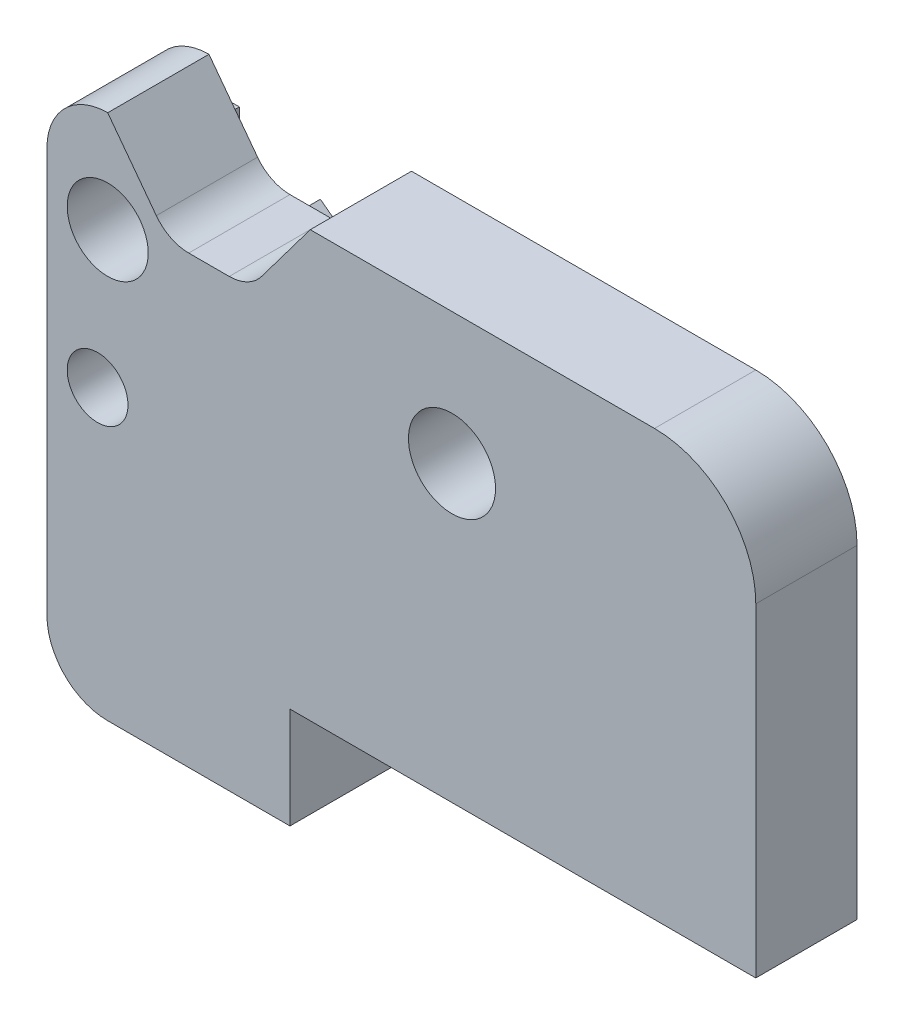
from build123d import *

# Parameters (mm, degrees)
SKETCH1_W             = 23
SKETCH1_H             = 21
EXTRUDE1_DEPTH        = 5
SKETCH2_R             = 2.15
EXTRUDE2_DEPTH        = 4.5
SKETCH4_R             = 1.25
EXTRUDE4_DEPTH        = 8
FILLET1_R             = 5
SKETCH6_R             = 4.5
EXTRUDE6_DEPTH        = 4.5
SKETCH9_W             = 12
SKETCH9_H             = 26
EXTRUDE9_DEPTH        = 5
SKETCH10_R            = 2
EXTRUDE10_DEPTH       = 4
SKETCH11_R            = 1.5
EXTRUDE11_DEPTH       = 5
M3_TAPPED_HOLE1_D     = 2.5
M3_TAPPED_HOLE1_DEPTH = 8
M3_TAPPED_HOLE1_TIP   = 0.751075774
EXTRUDE12_DEPTH       = 4
FILLET3_R             = 3
EXTRUDE14_DEPTH       = 4
FILLET4_R             = 2
EXTRUDE15_DEPTH       = 5
FILLET6_R             = 2


with BuildPart() as part:
    # Sketch1 → Extrude1 (new body)
    with BuildSketch(Plane.XY):
        with Locations((3.5, -4)):
            Rectangle(SKETCH1_W, SKETCH1_H)
    extrude(amount=EXTRUDE1_DEPTH)

    # Sketch2 → Extrude2 (cut)
    with BuildSketch(Plane.XY.offset(5)):
        Circle(SKETCH2_R)
    extrude(amount=-EXTRUDE2_DEPTH, mode=Mode.SUBTRACT)

    # Sketch4 → Extrude4 (cut)
    with BuildSketch(Plane.XZ.offset(14.5)):
        with Locations(Location((-1.4, 2.5, 0), (0, 0, 270))):
            Circle(SKETCH4_R)
        with Locations(Location((12, 2.5, 0), (0, 0, 270))):
            Circle(SKETCH4_R)
    extrude(amount=-EXTRUDE4_DEPTH, mode=Mode.SUBTRACT)

    # Fillet1
    fillet1_edges = [part.edges().sort_by_distance(p)[0] for p in [
        (15, 6.5, 2.5),
    ]]
    fillet(fillet1_edges, radius=FILLET1_R)

    # Sketch6 → Extrude6 (cut)
    with BuildSketch(Plane(origin=(0, 0, 0), x_dir=(-1, 0, 0), z_dir=(0, 0, -1))):
        with Locations((-4.9, -6.5)):
            Circle(SKETCH6_R)
    extrude(amount=-EXTRUDE6_DEPTH, mode=Mode.SUBTRACT)

    # Sketch9 → Extrude9 (add)
    with BuildSketch(Plane(origin=(0, 0, 0), x_dir=(-1, 0, 0), z_dir=(0, 0, -1))):
        with Locations((14, -6.5)):
            Rectangle(SKETCH9_W, SKETCH9_H)
    extrude(amount=-EXTRUDE9_DEPTH)

    # Sketch10 → Extrude10 (cut)
    with BuildSketch(Plane.XY.offset(5)):
        with Locations((-17, 1.5)):
            Circle(SKETCH10_R)
    extrude(amount=-EXTRUDE10_DEPTH, mode=Mode.SUBTRACT)

    # Sketch11 → Extrude11 (cut)
    with BuildSketch(Plane.XY.offset(5)):
        with Locations((-17.5, -5.5)):
            Circle(SKETCH11_R)
    extrude(amount=-EXTRUDE11_DEPTH, mode=Mode.SUBTRACT)

    # M3 Tapped Hole1
    with Locations(Plane(origin=(-1.4, -14.5, 2.5), x_dir=(0, 0, -1), z_dir=(0, -1, 0))):
        with Locations((0, 0), (0, 13.4)):
            Hole(M3_TAPPED_HOLE1_D / 2, depth=M3_TAPPED_HOLE1_DEPTH)
            with Locations((0, 0, -(M3_TAPPED_HOLE1_DEPTH + M3_TAPPED_HOLE1_TIP / 2))):  # 118° drill point
                Cone(0, M3_TAPPED_HOLE1_D / 2, M3_TAPPED_HOLE1_TIP, mode=Mode.SUBTRACT)

    # Sketch13 → Extrude12 (add)
    with BuildSketch(Plane(origin=(0, 0, 0), x_dir=(-1, 0, 0), z_dir=(0, 0, -1))):
        Polygon((20, -19.5), (8, -19.5), (8, -14.5), (2, -14.5), (2, -11.07), (18.1, 1), (20, 1), align=None)
    extrude(amount=EXTRUDE12_DEPTH)

    # Fillet3
    fillet3_edges = [part.edges().sort_by_distance(p)[0] for p in [
        (-20, -19.5, 0.5),
        (-20, 6.5, 2.5),
    ]]
    fillet(fillet3_edges, radius=FILLET3_R)

    # Sketch14 → Extrude14 (cut)
    with BuildSketch(Plane(origin=(0, 0, -4), x_dir=(-1, 0, 0), z_dir=(0, 0, -1))):
        Polygon((19.5, 1), (19.5, -7.5), (15.5, -7.5), (15.5, -0.949192547), (18.1, 1), align=None)
    extrude(amount=-EXTRUDE14_DEPTH, mode=Mode.SUBTRACT)

    # Fillet4
    fillet4_edges = [part.edges().sort_by_distance(p)[0] for p in [
        (-19.5, -7.5, -2),
        (-15.5, -7.5, -2),
    ]]
    fillet(fillet4_edges, radius=FILLET4_R - 0.0001)  # a hair under: the kernel refuses the full size

    # Sketch15 → Extrude15 (cut)
    with BuildSketch(Plane.XY.offset(5)):
        Polygon((-14, 2.5), (-17, 6.5), (-7, 6.5), (-10, 2.5), align=None)
    extrude(amount=-EXTRUDE15_DEPTH, mode=Mode.SUBTRACT)

    # Fillet6
    fillet6_edges = [part.edges().sort_by_distance(p)[0] for p in [
        (-10, 2.5, 2.5),
        (-14, 2.5, 2.5),
    ]]
    fillet(fillet6_edges, radius=FILLET6_R)


solid = part.part
